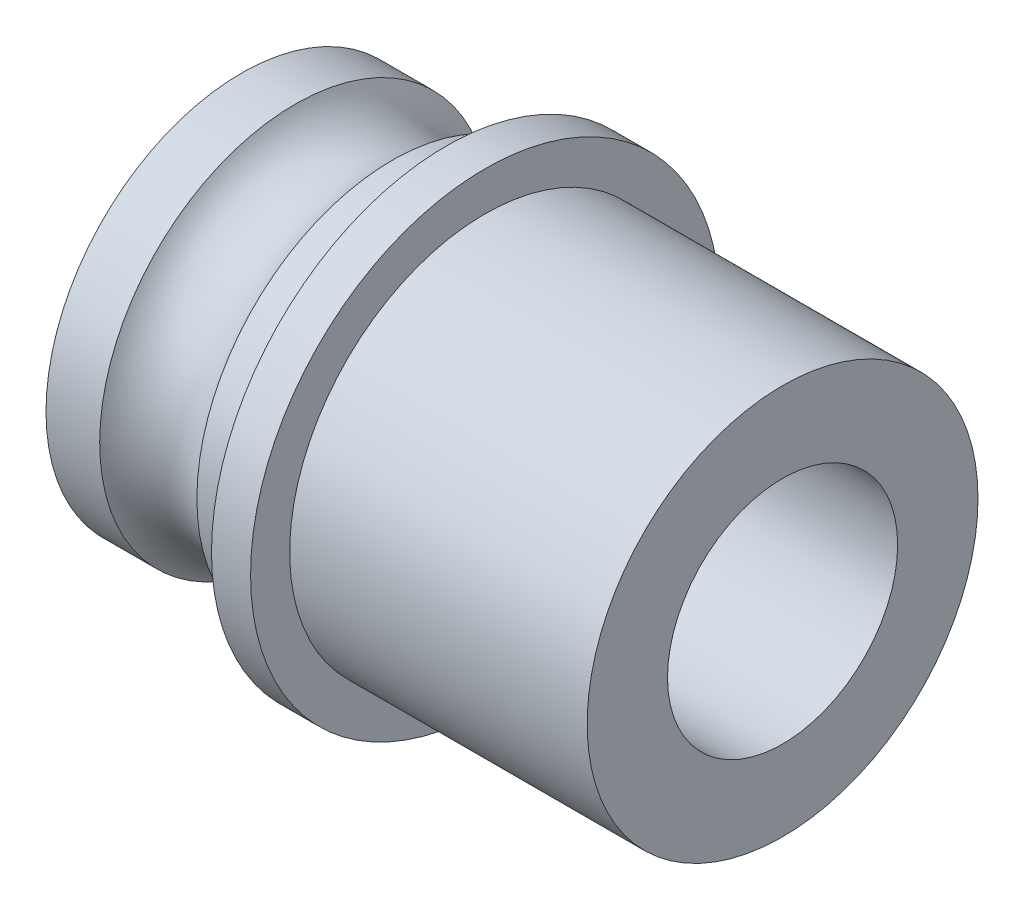
from build123d import *

# Parameters (mm, degrees)
SCALE1_SCALE        = 6
SKETCH4_R           = 45.852
BOSS_EXTRUDE1_DEPTH = 12.7
SKETCH5_R           = 27
CUT_EXTRUDE1_DEPTH  = 84.317043923
SCALE2_SCALE        = 3.323882225
SKETCH7_R           = 152.406647765
SKETCH7_R_2         = 89.744820066
BOSS_EXTRUDE2_DEPTH = 33.99
SCALE3_SCALE        = 0.416652997
BOSS_EXTRUDE3_START = -31.75
SKETCH8_R           = 76.200686546
BOSS_EXTRUDE3_DEPTH = 12.7
SKETCH9_R           = 63.500686546
SKETCH9_R_2         = 37.392448241
BOSS_EXTRUDE4_DEPTH = 19.05
SKETCH10_R          = 37.392448241
CUT_EXTRUDE2_DEPTH  = 137.337641642
SCALE4_SCALE        = 0.70539227
SKETCH11_R          = 44.792893449
SKETCH11_R_2        = 26.376343957
BOSS_EXTRUDE5_DEPTH = 41.32
SCALE5_SCALE        = 0.666666667


with BuildPart() as part:
    # Sketch1 → Revolve1 (revolve)
    with BuildSketch(Plane.XY):
        with BuildLine():
            Line((0, 0), (4, 0))
            Line((4, 0), (4, 3.142))
            Line((4, 3.142), (1.9, 3.142))
            ThreePointArc((1.9, 3.142), (0, 2.051053651), (-1.9, 3.142))
            Line((-1.9, 3.142), (-4, 3.142))
            Line((-4, 3.142), (-4, 0))
            Line((-4, 0), (0, 0))
        make_face()
    revolve(axis=Axis((-4, -4.5, 0), (1, 0, 0)))


with BuildPart() as part_1:
    # Scale1: scaled about (0, -4.5, 0)
    add(part.part.scale(SCALE1_SCALE).moved(Location((0, 22.5, 0))))

    # Sketch4 → Boss-Extrude1 (add)
    with BuildSketch(Plane(origin=(24, 0, 0), x_dir=(0, 0, -1), z_dir=(1, 0, 0))):
        with Locations((0, -4.5)):
            Circle(SKETCH4_R)
    extrude(amount=BOSS_EXTRUDE1_DEPTH)

    # Sketch5 → Cut-Extrude1 (cut, through all)
    with BuildSketch(Plane.ZY.offset(-24)):
        with Locations((0, -4.5)):
            Circle(SKETCH5_R)
    extrude(amount=-CUT_EXTRUDE1_DEPTH, mode=Mode.SUBTRACT)


with BuildPart() as part_2:
    # Scale2: scaled about (7.131190873, -4.5, 0)
    add(part_1.part.scale(SCALE2_SCALE).moved(Location((-16.57204771, 10.457470011, 0))))

    # Sketch7 → Boss-Extrude2 (add)
    with BuildSketch(Plane(origin=(105.414429934, 0, 0), x_dir=(0, 0, -1), z_dir=(1, 0, 0))):
        with Locations((0, -4.5)):
            Circle(SKETCH7_R)
        with Locations((0, -4.5)):
            Circle(SKETCH7_R_2, mode=Mode.SUBTRACT)
    extrude(amount=BOSS_EXTRUDE2_DEPTH)


with BuildPart() as part_3:
    # Scale3: scaled about (25.471225568, -4.5, 0)
    add(part_2.part.scale(SCALE3_SCALE).moved(Location((14.858563099, -2.625061514, 0))))

    # Sketch8 → Boss-Extrude3 (add)
    with BuildSketch(Plane(origin=(72.941836619, 0, 0), x_dir=(0, 0, -1), z_dir=(1, 0, 0)).offset(BOSS_EXTRUDE3_START)):
        with Locations((0, -4.5)):
            Circle(SKETCH8_R)
    extrude(amount=BOSS_EXTRUDE3_DEPTH)

    # Sketch9 → Boss-Extrude4 (add)
    with BuildSketch(Plane(origin=(72.941836619, 0, 0), x_dir=(0, 0, -1), z_dir=(1, 0, 0))):
        with Locations((0, -4.5)):
            Circle(SKETCH9_R)
        with Locations((0, -4.5)):
            Circle(SKETCH9_R_2, mode=Mode.SUBTRACT)
    extrude(amount=BOSS_EXTRUDE4_DEPTH)

    # Sketch10 → Cut-Extrude2 (cut, through all)
    with BuildSketch(Plane(origin=(53.891836619, 0, 0), x_dir=(0, 0, -1), z_dir=(1, 0, 0))):
        with Locations((0, -4.5)):
            Circle(SKETCH10_R)
    extrude(amount=-CUT_EXTRUDE2_DEPTH, mode=Mode.SUBTRACT)


with BuildPart() as part_4:
    # Scale4: scaled about (36.400291081, -4.5, 0)
    add(part_3.part.scale(SCALE4_SCALE).moved(Location((10.723807116, -1.325734784, 0))))

    # Sketch11 → Boss-Extrude5 (add)
    with BuildSketch(Plane(origin=(75.614137598, 0, 0), x_dir=(0, 0, -1), z_dir=(1, 0, 0))):
        with Locations((0, -4.5)):
            Circle(SKETCH11_R)
        with Locations((0, -4.5)):
            Circle(SKETCH11_R_2, mode=Mode.SUBTRACT)
    extrude(amount=BOSS_EXTRUDE5_DEPTH)


with BuildPart() as part_5:
    # Scale5: scaled about (56.419036868, -4.5, 0)
    add(part_4.part.scale(SCALE5_SCALE).moved(Location((18.806345623, -1.5, 0))))


solid = part_5.part
